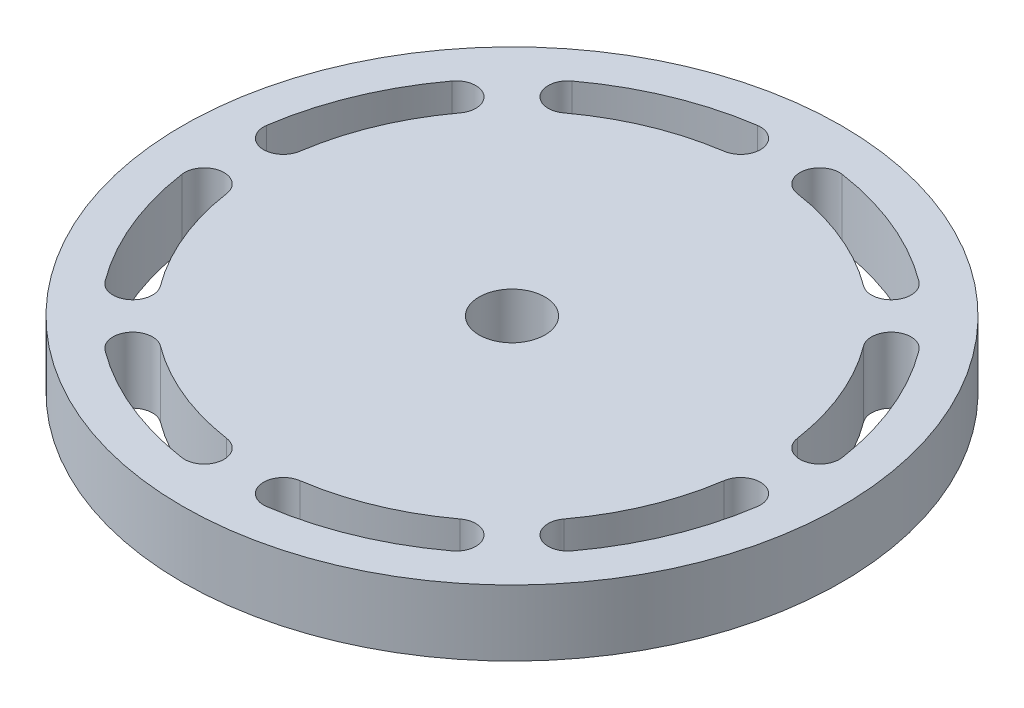
from build123d import *

# Parameters (mm, degrees)
SKETCH1_R           = 31.75
BOSS_EXTRUDE1_DEPTH = 6.35
SKETCH2_R           = 3.175
CUT_EXTRUDE1_DEPTH  = 46.348070521
CUT_EXTRUDE2_DEPTH  = 46.348070521


with BuildPart() as part:
    # Sketch1 → Boss-Extrude1 (new body)
    with BuildSketch(Plane(origin=(0, 0, 0), x_dir=(1, 0, 0), z_dir=(0, 1, 0))):
        Circle(SKETCH1_R)
    extrude(amount=BOSS_EXTRUDE1_DEPTH)

    # Sketch2 → Cut-Extrude1 (cut, through all)
    with BuildSketch(Plane(origin=(0, 6.35, 0), x_dir=(1, 0, 0), z_dir=(0, 1, 0))):
        Circle(SKETCH2_R)
    extrude(amount=-CUT_EXTRUDE1_DEPTH, mode=Mode.SUBTRACT)

    # Sketch3 → Cut-Extrude2 (cut, through all)
    with BuildSketch(Plane(origin=(0, 6.35, 0), x_dir=(1, 0, 0), z_dir=(0, 1, 0))):
        with BuildLine():
            ThreePointArc((-4.087893238, 27.72335831), (-10.723985199, 25.889990509), (-16.712797629, 22.493951688))
            ThreePointArc((-16.712797629, 22.493951688), (-17.105798015, 19.828693596), (-14.440539923, 19.43569321))
            ThreePointArc((-14.440539923, 19.43569321), (-9.265961321, 22.370009491), (-3.532106762, 23.954114169))
            ThreePointArc((-3.532106762, 23.954114169), (-1.92537793, 26.116629478), (-4.087893238, 27.72335831))
        make_face()
        with BuildLine():
            ThreePointArc((-27.72335831, 4.087893238), (-25.889990509, 10.723985199), (-22.493951688, 16.712797629))
            ThreePointArc((-22.493951688, 16.712797629), (-19.828693596, 17.105798015), (-19.43569321, 14.440539923))
            ThreePointArc((-19.43569321, 14.440539923), (-22.370009491, 9.265961321), (-23.954114169, 3.532106762))
            ThreePointArc((-23.954114169, 3.532106762), (-26.116629478, 1.92537793), (-27.72335831, 4.087893238))
        make_face()
        with BuildLine():
            ThreePointArc((-27.72335831, -4.087893238), (-25.889990509, -10.723985199), (-22.493951688, -16.712797629))
            ThreePointArc((-22.493951688, -16.712797629), (-19.828693596, -17.105798015), (-19.43569321, -14.440539923))
            ThreePointArc((-19.43569321, -14.440539923), (-22.370009491, -9.265961321), (-23.954114169, -3.532106762))
            ThreePointArc((-23.954114169, -3.532106762), (-26.116629478, -1.92537793), (-27.72335831, -4.087893238))
        make_face()
        with BuildLine():
            ThreePointArc((-4.087893238, -27.72335831), (-10.723985199, -25.889990509), (-16.712797629, -22.493951688))
            ThreePointArc((-16.712797629, -22.493951688), (-17.105798015, -19.828693596), (-14.440539923, -19.43569321))
            ThreePointArc((-14.440539923, -19.43569321), (-9.265961321, -22.370009491), (-3.532106762, -23.954114169))
            ThreePointArc((-3.532106762, -23.954114169), (-1.92537793, -26.116629478), (-4.087893238, -27.72335831))
        make_face()
        with BuildLine():
            ThreePointArc((4.087893238, -27.72335831), (10.723985199, -25.889990509), (16.712797629, -22.493951688))
            ThreePointArc((16.712797629, -22.493951688), (17.105798015, -19.828693596), (14.440539923, -19.43569321))
            ThreePointArc((14.440539923, -19.43569321), (9.265961321, -22.370009491), (3.532106762, -23.954114169))
            ThreePointArc((3.532106762, -23.954114169), (1.92537793, -26.116629478), (4.087893238, -27.72335831))
        make_face()
        with BuildLine():
            ThreePointArc((27.72335831, -4.087893238), (25.889990509, -10.723985199), (22.493951688, -16.712797629))
            ThreePointArc((22.493951688, -16.712797629), (19.828693596, -17.105798015), (19.43569321, -14.440539923))
            ThreePointArc((19.43569321, -14.440539923), (22.370009491, -9.265961321), (23.954114169, -3.532106762))
            ThreePointArc((23.954114169, -3.532106762), (26.116629478, -1.92537793), (27.72335831, -4.087893238))
        make_face()
        with BuildLine():
            ThreePointArc((27.72335831, 4.087893238), (25.889990509, 10.723985199), (22.493951688, 16.712797629))
            ThreePointArc((22.493951688, 16.712797629), (19.828693596, 17.105798015), (19.43569321, 14.440539923))
            ThreePointArc((19.43569321, 14.440539923), (22.370009491, 9.265961321), (23.954114169, 3.532106762))
            ThreePointArc((23.954114169, 3.532106762), (26.116629478, 1.92537793), (27.72335831, 4.087893238))
        make_face()
        with BuildLine():
            ThreePointArc((4.087893238, 27.72335831), (10.723985199, 25.889990509), (16.712797629, 22.493951688))
            ThreePointArc((16.712797629, 22.493951688), (17.105798015, 19.828693596), (14.440539923, 19.43569321))
            ThreePointArc((14.440539923, 19.43569321), (9.265961321, 22.370009491), (3.532106762, 23.954114169))
            ThreePointArc((3.532106762, 23.954114169), (1.92537793, 26.116629478), (4.087893238, 27.72335831))
        make_face()
    extrude(amount=-CUT_EXTRUDE2_DEPTH, mode=Mode.SUBTRACT)


solid = part.part
